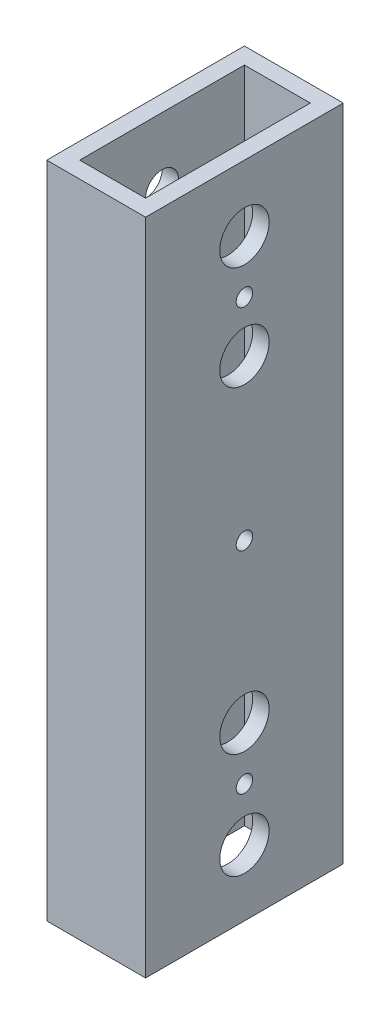
from build123d import *

# Parameters (mm, degrees)
SKETCH1_W           = 19.05
SKETCH1_H           = 38.1
SKETCH1_W_2         = 12.7
SKETCH1_H_2         = 31.75
BOSS_EXTRUDE1_DEPTH = 127
SKETCH2_R           = 3.175
CUT_EXTRUDE1_DEPTH  = 134.953396747
CUT_EXTRUDE2_REACH  = 135.953
SKETCH3_R           = 4.7625
SKETCH4_R           = 1.5875
UCHAN_MOUNT_DEPTH   = 134.953396747
CUT_EXTRUDE4_REACH  = 135.953
SKETCH5_R           = 4.7625


with BuildPart() as part:
    # Sketch1 → Boss-Extrude1 (new body)
    with BuildSketch(Plane(origin=(0, 0, 0), x_dir=(1, 0, 0), z_dir=(0, 1, 0))):
        with Locations((9.525, 19.05)):
            Rectangle(SKETCH1_W, SKETCH1_H)
        with Locations((9.525, 19.05)):
            Rectangle(SKETCH1_W_2, SKETCH1_H_2, mode=Mode.SUBTRACT)
    extrude(amount=BOSS_EXTRUDE1_DEPTH)

    # Sketch2 → Cut-Extrude1 (cut, through all)
    with BuildSketch(Plane(origin=(19.05, 0, 0), x_dir=(0, 0, -1), z_dir=(1, 0, 0))):
        with Locations((19.05, 12.7)):
            Circle(SKETCH2_R)
        with Locations((19.05, 32.69996)):
            Circle(SKETCH2_R)
        with Locations((19.05, 94.30004)):
            Circle(SKETCH2_R)
        with Locations((19.05, 114.3)):
            Circle(SKETCH2_R)
    extrude(amount=-CUT_EXTRUDE1_DEPTH, mode=Mode.SUBTRACT)

    # Sketch3 → Cut-Extrude2 (cut, up to next)
    with BuildSketch(Plane(origin=(19.05, 0, 0), x_dir=(0, 0, -1), z_dir=(1, 0, 0)), mode=Mode.PRIVATE) as cut_extrude2_sk1:
        with Locations((19.05, 114.3)):
            Circle(SKETCH3_R)
    cut_extrude2_tool1 = extrude(cut_extrude2_sk1.sketch, amount=-CUT_EXTRUDE2_REACH, mode=Mode.PRIVATE) & part.part
    # Sketch3 → Cut-Extrude2 (cut, up to next)
    with BuildSketch(Plane(origin=(19.05, 0, 0), x_dir=(0, 0, -1), z_dir=(1, 0, 0)), mode=Mode.PRIVATE) as cut_extrude2_sk2:
        with Locations((19.05, 94.30004)):
            Circle(SKETCH3_R)
    cut_extrude2_tool2 = extrude(cut_extrude2_sk2.sketch, amount=-CUT_EXTRUDE2_REACH, mode=Mode.PRIVATE) & part.part
    # Sketch3 → Cut-Extrude2 (cut, up to next)
    with BuildSketch(Plane(origin=(19.05, 0, 0), x_dir=(0, 0, -1), z_dir=(1, 0, 0)), mode=Mode.PRIVATE) as cut_extrude2_sk3:
        with Locations((19.05, 33.059408242)):
            Circle(SKETCH3_R)
    cut_extrude2_tool3 = extrude(cut_extrude2_sk3.sketch, amount=-CUT_EXTRUDE2_REACH, mode=Mode.PRIVATE) & part.part
    # Sketch3 → Cut-Extrude2 (cut, up to next)
    with BuildSketch(Plane(origin=(19.05, 0, 0), x_dir=(0, 0, -1), z_dir=(1, 0, 0)), mode=Mode.PRIVATE) as cut_extrude2_sk4:
        with Locations((19.05, 12.7)):
            Circle(SKETCH3_R)
    cut_extrude2_tool4 = extrude(cut_extrude2_sk4.sketch, amount=-CUT_EXTRUDE2_REACH, mode=Mode.PRIVATE) & part.part
    add(cut_extrude2_tool1.solids().sort_by_distance((19.05, 114.3, -19.05))[0], mode=Mode.SUBTRACT)
    add(cut_extrude2_tool2.solids().sort_by_distance((19.05, 94.30004, -19.05))[0], mode=Mode.SUBTRACT)
    add(cut_extrude2_tool3.solids().sort_by_distance((19.05, 33.059408, -19.05))[0], mode=Mode.SUBTRACT)
    add(cut_extrude2_tool4.solids().sort_by_distance((19.05, 12.7, -19.05))[0], mode=Mode.SUBTRACT)

    # Sketch4 → UChan_Mount (cut, through all)
    with BuildSketch(Plane(origin=(19.05, 0, 0), x_dir=(0, 0, -1), z_dir=(1, 0, 0))):
        with Locations((19.05, 22.879704121)):
            Circle(SKETCH4_R)
        with Locations((19.05, 63.5)):
            Circle(SKETCH4_R)
        with Locations((19.05, 104.120295879)):
            Circle(SKETCH4_R)
    extrude(amount=-UCHAN_MOUNT_DEPTH, mode=Mode.SUBTRACT)

    # Sketch5 → Cut-Extrude4 (cut, up to next)
    with BuildSketch(Plane.ZY, mode=Mode.PRIVATE) as cut_extrude4_sk1:
        with Locations((-19.05, 104.120295879)):
            Circle(SKETCH5_R)
    cut_extrude4_tool1 = extrude(cut_extrude4_sk1.sketch, amount=-CUT_EXTRUDE4_REACH, mode=Mode.PRIVATE) & part.part
    # Sketch5 → Cut-Extrude4 (cut, up to next)
    with BuildSketch(Plane.ZY, mode=Mode.PRIVATE) as cut_extrude4_sk2:
        with Locations((-19.05, 63.5)):
            Circle(SKETCH5_R)
    cut_extrude4_tool2 = extrude(cut_extrude4_sk2.sketch, amount=-CUT_EXTRUDE4_REACH, mode=Mode.PRIVATE) & part.part
    # Sketch5 → Cut-Extrude4 (cut, up to next)
    with BuildSketch(Plane.ZY, mode=Mode.PRIVATE) as cut_extrude4_sk3:
        with Locations((-19.05, 22.879704121)):
            Circle(SKETCH5_R)
    cut_extrude4_tool3 = extrude(cut_extrude4_sk3.sketch, amount=-CUT_EXTRUDE4_REACH, mode=Mode.PRIVATE) & part.part
    add(cut_extrude4_tool1.solids().sort_by_distance((0, 104.120296, -19.05))[0], mode=Mode.SUBTRACT)
    add(cut_extrude4_tool2.solids().sort_by_distance((0, 63.5, -19.05))[0], mode=Mode.SUBTRACT)
    add(cut_extrude4_tool3.solids().sort_by_distance((0, 22.879704, -19.05))[0], mode=Mode.SUBTRACT)


solid = part.part
